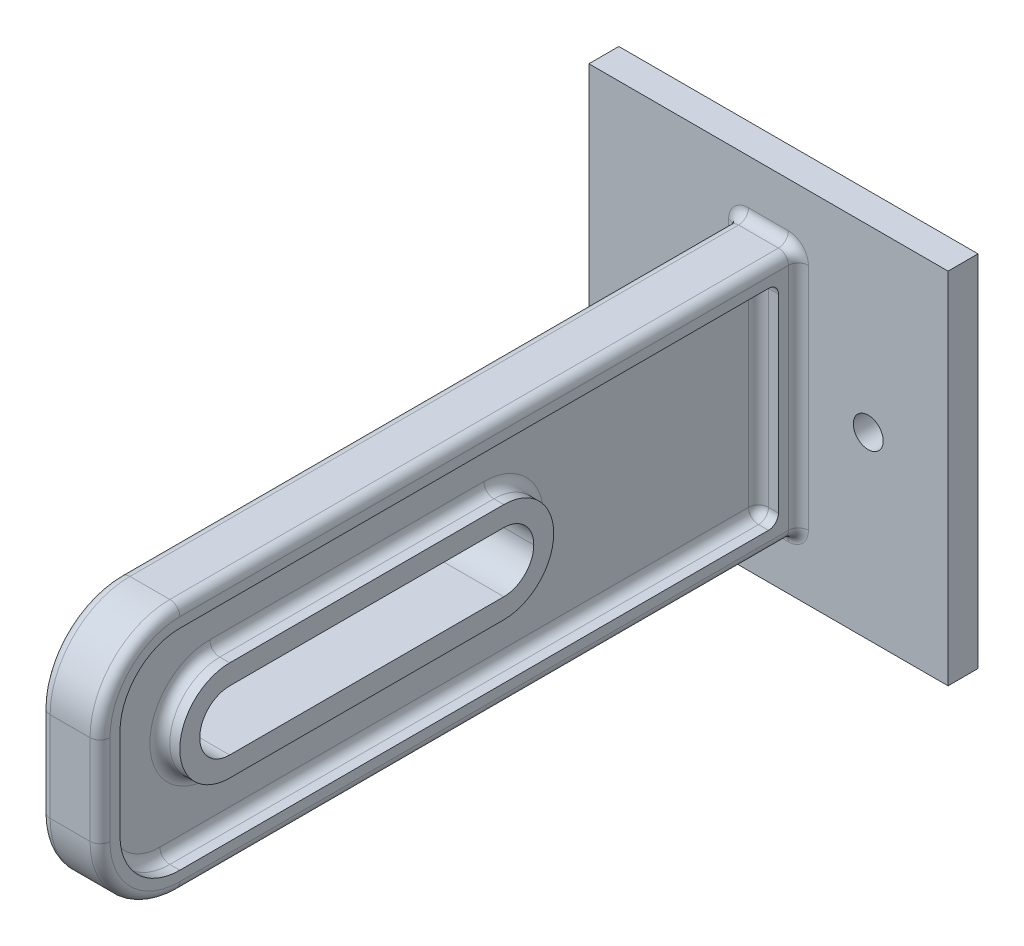
from build123d import *

# Parameters (mm, degrees)
SKETCH1_W           = 36
SKETCH1_H           = 36
BOSS_EXTRUDE1_DEPTH = 3
SKETCH2_R           = 1.5
CUT_EXTRUDE1_DEPTH  = 3
SKETCH3_W           = 6
SKETCH3_H           = 25
BOSS_EXTRUDE2_DEPTH = 70
SKETCH4_W           = 33.475190479
SKETCH4_H           = 6
CUT_EXTRUDE2_DEPTH  = 70
FILLET1_R           = 3
FILLET2_R           = 8
CUT_EXTRUDE3_DEPTH  = 2
FILLET3_R           = 1
FILLET4_R           = 1
FILLET5_R           = 1
FILLET6_R           = 1
FILLET7_R           = 1
FILLET8_R           = 1
FILLET10_R          = 1
FILLET11_R          = 1


with BuildPart() as part:
    # Sketch1 → Boss-Extrude1 (new body)
    with BuildSketch(Plane.XY):
        Rectangle(SKETCH1_W, SKETCH1_H)
    extrude(amount=BOSS_EXTRUDE1_DEPTH)

    # Sketch2 → Cut-Extrude1 (cut)
    with BuildSketch(Plane.XY.offset(3)):
        with Locations((-10, 0)):
            Circle(SKETCH2_R)
        with Locations((10, 0)):
            Circle(SKETCH2_R)
    extrude(amount=-CUT_EXTRUDE1_DEPTH, mode=Mode.SUBTRACT)

    # Sketch3 → Boss-Extrude2 (add)
    with BuildSketch(Plane.XY.offset(3)):
        Rectangle(SKETCH3_W, SKETCH3_H)
    extrude(amount=BOSS_EXTRUDE2_DEPTH)

    # Sketch4 → Cut-Extrude2 (cut)
    with BuildSketch(Plane(origin=(3, 0, 0), x_dir=(0, 0, -1), z_dir=(1, 0, 0))):
        with Locations((-46.262404761, 0)):
            Rectangle(SKETCH4_W, SKETCH4_H)
    extrude(amount=-CUT_EXTRUDE2_DEPTH, mode=Mode.SUBTRACT)

    # Fillet1
    fillet1_edges = [part.edges().sort_by_distance(p)[0] for p in [
        (0, -3, 63),
        (0, 3, 63),
        (0, 3, 29.524809521),
        (0, -3, 29.524809521),
    ]]
    fillet(fillet1_edges, radius=FILLET1_R - 0.0001)  # a hair under: the kernel refuses the full size

    # Fillet2
    fillet2_edges = [part.edges().sort_by_distance(p)[0] for p in [
        (0, 12.5, 73),
        (0, -12.5, 73),
    ]]
    fillet(fillet2_edges, radius=FILLET2_R)

    # Sketch6 → Cut-Extrude3 (cut)
    with BuildSketch(Plane(origin=(3, 0, 0), x_dir=(0, 0, -1), z_dir=(1, 0, 0))):
        with BuildLine():
            Line((-65, -10.5), (-5, -10.5))
            Line((-5, -10.5), (-5, 10.5))
            Line((-5, 10.5), (-65, 10.5))
            ThreePointArc((-65, 10.5), (-69.242640687, 8.742640687), (-71, 4.5))
            Line((-71, 4.5), (-71, -4.5))
            ThreePointArc((-71, -4.5), (-69.242640687, -8.742640687), (-65, -10.5))
        make_face()
        with BuildLine():
            Line((-32.524809521, 5), (-60, 5))
            ThreePointArc((-60, 5), (-63.535533906, 3.535533906), (-65, 0))
            ThreePointArc((-65, 0), (-63.535533906, -3.535533906), (-60, -5))
            Line((-60, -5), (-32.524809521, -5))
            ThreePointArc((-32.524809521, -5), (-28.989275615, -3.535533906), (-27.524809521, 0))
            ThreePointArc((-27.524809521, 0), (-28.989275615, 3.535533906), (-32.524809521, 5))
        make_face(mode=Mode.SUBTRACT)
    cut_extrude3 = extrude(amount=-CUT_EXTRUDE3_DEPTH, mode=Mode.SUBTRACT)

    # Mirror3: Cut-Extrude3 across plane
    add(cut_extrude3.mirror(Plane(origin=(0, 0, 0), x_dir=(0, 0, 1), z_dir=(1, 0, 0))), mode=Mode.SUBTRACT)

    # Fillet3
    fillet3_edges = [part.edges().sort_by_distance(p)[0] for p in [
        (-1, 10.5, 35),
        (-1, 8.742640687, 69.242640687),
        (-1, -10.5, 35),
        (-1, -8.742640687, 69.242640687),
        (-3, 10.5, 35),
        (-3, 8.742640687, 69.242640687),
        (-3, -10.5, 35),
        (-3, -8.742640687, 69.242640687),
        (-1, 0, 71),
        (-3, 0, 71),
    ]]
    fillet(fillet3_edges, radius=FILLET3_R - 0.0001)  # a hair under: the kernel refuses the full size

    # Fillet4
    fillet4_edges = [part.edges().sort_by_distance(p)[0] for p in [
        (-1, 0, 5),
        (-1.292863929, -10.207136071, 5),
        (-1.292863929, 10.207136071, 5),
        (-2.707136071, 10.792863929, 5),
        (-2.707136071, -10.792863929, 5),
    ]]
    fillet(fillet4_edges, radius=FILLET4_R - 0.0001)  # a hair under: the kernel refuses the full size

    # Fillet5
    fillet5_edges = [part.edges().sort_by_distance(p)[0] for p in [
        (-3, 0, 73),
        (-3, -12.5, 34),
        (-3, 12.5, 34),
        (-3, 10.156854249, 70.656854249),
        (-3, -10.156854249, 70.656854249),
    ]]
    fillet(fillet5_edges, radius=FILLET5_R)

    # Fillet6
    fillet6_edges = [part.edges().sort_by_distance(p)[0] for p in [
        (-1, 0, 27.524809521),
        (-1, 5, 46.26240476),
        (-1, 0, 65),
        (-1, -5, 46.26240476),
    ]]
    fillet(fillet6_edges, radius=FILLET6_R)

    # Fillet7
    fillet7_edges = [part.edges().sort_by_distance(p)[0] for p in [
        (1, -8.742640687, 69.242640687),
        (1, 0, 71),
        (1, 8.742640687, 69.242640687),
        (1, 10.5, 35),
        (1, -10.5, 35),
    ]]
    fillet(fillet7_edges, radius=FILLET7_R)

    # Fillet8
    fillet8_edges = [part.edges().sort_by_distance(p)[0] for p in [
        (1, 0, 5),
        (2.5, 10.5, 5),
        (2.5, -10.5, 5),
        (1.292893219, 10.207106781, 5),
        (1.292893219, -10.207106781, 5),
    ]]
    fillet(fillet8_edges, radius=FILLET8_R)

    # Fillet10
    fillet10_edges = [part.edges().sort_by_distance(p)[0] for p in [
        (3, 0, 73),
        (3, 12.5, 34),
        (3, -12.5, 34),
        (3, 10.156854249, 70.656854249),
        (3, -10.156854249, 70.656854249),
    ]]
    fillet(fillet10_edges, radius=FILLET10_R)

    # Fillet11
    fillet11_edges = [part.edges().sort_by_distance(p)[0] for p in [
        (0, -12.5, 3),
        (-3, 0, 3),
        (-2.707106781, -12.207106781, 3),
        (-2.707106781, 12.207106781, 3),
        (0, 12.5, 3),
        (3, 0, 3),
        (2.707106781, 12.207106781, 3),
        (2.707106781, -12.207106781, 3),
        (1, 0, 65),
        (1, -5, 46.26240476),
        (1, 0, 27.524809521),
        (1, 5, 46.26240476),
    ]]
    fillet(fillet11_edges, radius=FILLET11_R)


solid = part.part
